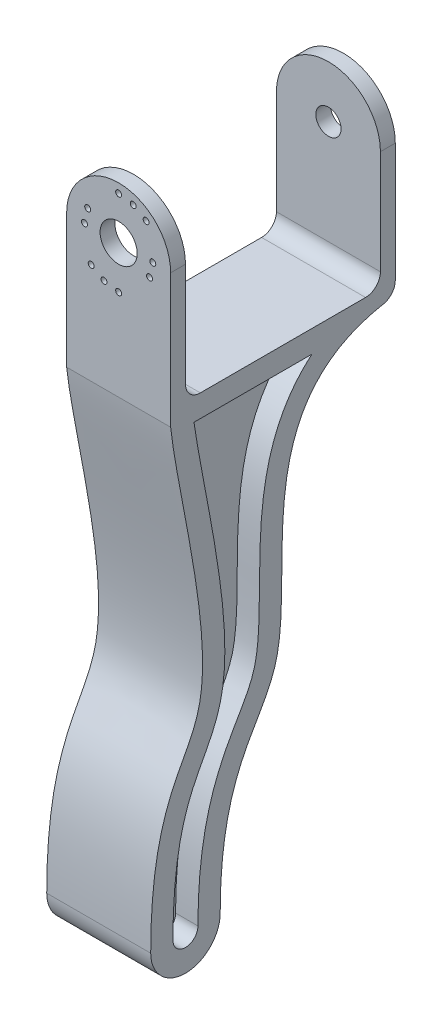
from build123d import *

# Parameters (mm, degrees)
SKETCH1_W           = 17.78
SKETCH1_H           = 33.3375
BOSS_EXTRUDE1_DEPTH = 2.54
SKETCH2_R           = 0.508
SKETCH2_R_2         = 3.175
BOSS_EXTRUDE2_DEPTH = 2.54
BOSS_EXTRUDE3_START = 2.54
SKETCH3_R           = 2.159
BOSS_EXTRUDE3_DEPTH = 2.54
BOSS_EXTRUDE5_DEPTH = 17.78
CUT_EXTRUDE2_DEPTH  = 3.81
CUT_EXTRUDE3_START  = -3.81
CUT_EXTRUDE3_DEPTH  = 3.81
FILLET1_START       = -19
FILLET1_DEPTH       = 20
FILLET1_START_2     = -17.78
FILLET1_2_DEPTH     = 17.78


with BuildPart() as part:
    # Sketch1 → Boss-Extrude1 (new body)
    with BuildSketch(Plane(origin=(0, 0, 0), x_dir=(1, 0, 0), z_dir=(0, 1, 0))):
        with Locations((-8.89, -16.66875)):
            Rectangle(SKETCH1_W, SKETCH1_H)
    extrude(amount=BOSS_EXTRUDE1_DEPTH)

    # Sketch2 → Boss-Extrude2 (add)
    with BuildSketch(Plane.XY.offset(33.3375)):
        with BuildLine():
            Line((-17.78, 0), (0, 0))
            Line((0, 0), (0, 22.86))
            ThreePointArc((0, 22.86), (-8.89, 31.75), (-17.78, 22.86))
            Line((-17.78, 22.86), (-17.78, 0))
        make_face()
        with Locations((-4.190027947, 28.448986398)):
            Circle(SKETCH2_R, mode=Mode.SUBTRACT)
        with Locations((-8.89, 15.5575)):
            Circle(SKETCH2_R, mode=Mode.SUBTRACT)
        with Locations((-13.589972053, 17.271013602)):
            Circle(SKETCH2_R, mode=Mode.SUBTRACT)
        with Locations((-14.732, 22.86)):
            Circle(SKETCH2_R, mode=Mode.SUBTRACT)
        with Locations((-11.391292974, 15.99923913)):
            Circle(SKETCH2_R, mode=Mode.SUBTRACT)
        with Locations((-14.179826087, 25.339254721)):
            Circle(SKETCH2_R, mode=Mode.SUBTRACT)
        with Locations((-8.89, 22.86)):
            Circle(SKETCH2_R_2, mode=Mode.SUBTRACT)
        with Locations((-3.600173913, 20.380745279)):
            Circle(SKETCH2_R, mode=Mode.SUBTRACT)
        with Locations((-3.048, 22.86)):
            Circle(SKETCH2_R, mode=Mode.SUBTRACT)
        with Locations((-8.89, 30.1625)):
            Circle(SKETCH2_R, mode=Mode.SUBTRACT)
        with Locations((-6.388707026, 29.72076087)):
            Circle(SKETCH2_R, mode=Mode.SUBTRACT)
    extrude(amount=BOSS_EXTRUDE2_DEPTH)

    # Sketch3 → Boss-Extrude3 (add)
    with BuildSketch(Plane(origin=(0, 0, 0), x_dir=(-1, 0, 0), z_dir=(0, 0, -1)).offset(BOSS_EXTRUDE3_START)):
        with BuildLine():
            Line((0, 22.86), (0, 0))
            Line((0, 0), (17.78, 0))
            Line((17.78, 0), (17.78, 22.86))
            ThreePointArc((17.78, 22.86), (8.89, 31.75), (0, 22.86))
        make_face()
        with Locations((8.89, 22.86)):
            Circle(SKETCH3_R, mode=Mode.SUBTRACT)
    extrude(amount=-BOSS_EXTRUDE3_DEPTH)

    # Sketch7 → Boss-Extrude5 (add)
    with BuildSketch(Plane.ZY.offset(17.78)):
        with BuildLine():
            Line((-0.264151635, 0), (35.8775, 0))
            add(Edge.make_bspline(
                [(35.8775, 0), (34.747575759, -10.483413435), (23.993931567, -49.656448715), (39.285331068, -53.149048012), (39.285331068, -76.2)],
                knots=[0, 0, 0, 0, 0.561590868, 1, 1, 1, 1], degree=3))
            ThreePointArc((39.285331068, -76.2), (33.341590809, -82.143740259), (27.39785055, -76.2))
            add(Edge.make_bspline(
                [(-0.264151635, 0), (22.699251274, -4.420985832), (9.107853477, -48.908327851), (27.39785055, -54.27437044), (27.39785055, -76.2)],
                knots=[0, 0, 0, 0, 0.58838778, 1, 1, 1, 1], degree=3))
        make_face()
    extrude(amount=-BOSS_EXTRUDE5_DEPTH)

    # Sketch8 → Cut-Extrude2 (cut)
    with BuildSketch(Plane.ZY.offset(17.78)):
        with BuildLine():
            Line((31.87998254, -1.27), (11.692102825, -1.27))
            add(Edge.make_bspline(
                [(11.692102825, -1.27), (12.329490215, -1.797961739), (12.933094236, -2.363198397), (13.787184198, -3.267673027), (14.063326101, -3.578603465), (14.598372835, -4.219482884), (14.857923986, -4.550402014), (16.097605696, -6.232124946), (16.914419625, -7.674525947), (17.924867424, -9.957247581), (18.226686047, -10.741395079), (18.75770144, -12.319459012), (18.988184221, -13.115418962), (19.592569091, -15.520520104), (19.879955273, -17.146774279), (20.299302948, -20.430025875), (20.430895911, -22.089601111), (20.599678207, -25.411936863), (20.636803846, -27.075451594), (20.67865973, -30.404089571), (20.682443911, -32.069259792), (20.720479253, -34.565408412), (20.738709961, -35.397182268), (20.801129707, -37.059441081), (20.845054145, -37.889939176), (20.982392235, -39.548478099), (21.074816708, -40.376568042), (21.286468297, -41.615077579), (21.36995575, -42.029357232), (21.572726897, -42.845983081), (21.691262012, -43.245940154), (22.363912109, -45.206759154), (23.165451305, -46.647067415), (24.407519941, -48.78815743), (24.827945274, -49.498734604), (25.64468202, -50.93163809), (26.041618909, -51.654615352), (27.165466006, -53.845963493), (27.8234689, -55.338028422), (28.933619451, -58.392484093), (29.388551341, -59.953923666), (30.126668316, -63.135476247), (30.410939534, -64.760898165), (30.838079835, -68.014087747), (30.982595978, -69.645919189), (31.167543607, -72.917475244), (31.20785055, -74.557209301), (31.20785055, -76.2)],
                knots=[0, 0, 0, 0, 0.03125, 0.03125, 0.046875, 0.046875, 0.0625, 0.0625, 0.125, 0.125, 0.15625, 0.15625, 0.1875, 0.1875, 0.25, 0.25, 0.3125, 0.3125, 0.375, 0.375, 0.4375, 0.4375, 0.46875, 0.46875, 0.5, 0.5, 0.53125, 0.53125, 0.546875, 0.546875, 0.5625, 0.5625, 0.625, 0.625, 0.65625, 0.65625, 0.6875, 0.6875, 0.75, 0.75, 0.8125, 0.8125, 0.875, 0.875, 0.9375, 0.9375, 1, 1, 1, 1], degree=3))
            ThreePointArc((31.20785055, -76.2), (33.341590809, -78.333740259), (35.475331068, -76.2))
            add(Edge.make_bspline(
                [(35.475331068, -76.2), (35.475331068, -74.59891608), (35.442328522, -73.001625639), (35.287530724, -69.817251041), (35.166036456, -68.230132286), (34.79753857, -65.070321456), (34.55101578, -63.497574112), (34.039906006, -61.154697774), (33.84568435, -60.376480634), (33.398546609, -58.826792987), (33.146503607, -58.05990662), (32.584304123, -56.555872408), (32.273225256, -55.817082229), (31.598571017, -54.362663568), (31.234783966, -53.64712848), (30.484711446, -52.225984708), (30.099036577, -51.51989769), (29.353314006, -50.097553632), (28.994109895, -49.38118555), (28.341640461, -47.923362101), (28.048377395, -47.181905876), (27.546707249, -45.666708842), (27.338073983, -44.893054089), (27.09111876, -43.70746341), (27.01970601, -43.307296259), (26.897279987, -42.509162839), (26.845976833, -42.1100683), (26.716854196, -40.912715076), (26.663581813, -40.114387456), (26.574836598, -37.719205009), (26.609016601, -36.12215458), (26.785471939, -32.927750164), (26.929107807, -31.328947255), (27.463994787, -26.542252957), (27.955318949, -23.373254872), (29.041327858, -17.052236889), (29.640872623, -13.901015305), (30.531911147, -9.172823068), (30.827709929, -7.596559566), (31.390084509, -4.439232344), (31.659048397, -2.858560896), (31.87998254, -1.27)],
                knots=[0, 0, 0, 0, 0.0625, 0.0625, 0.125, 0.125, 0.1875, 0.1875, 0.21875, 0.21875, 0.25, 0.25, 0.28125, 0.28125, 0.3125, 0.3125, 0.34375, 0.34375, 0.375, 0.375, 0.40625, 0.40625, 0.4375, 0.4375, 0.453125, 0.453125, 0.46875, 0.46875, 0.5, 0.5, 0.5625, 0.5625, 0.625, 0.625, 0.75, 0.75, 0.875, 0.875, 0.9375, 0.9375, 1, 1, 1, 1], degree=3))
        make_face()
    extrude(amount=-CUT_EXTRUDE2_DEPTH, mode=Mode.SUBTRACT)

    # Sketch9 → Cut-Extrude3 (cut)
    with BuildSketch(Plane(origin=(0, 0, 0), x_dir=(0, 0, -1), z_dir=(1, 0, 0)).offset(CUT_EXTRUDE3_START)):
        with BuildLine():
            Line((-11.692102825, -1.27), (-31.87998254, -1.27))
            add(Edge.make_bspline(
                [(-31.87998254, -1.27), (-31.657274592, -2.871314909), (-31.385801547, -4.464709015), (-30.818371841, -7.647520411), (-30.519962643, -9.236539341), (-29.621517161, -14.003073455), (-29.017536871, -17.179948025), (-28.199208606, -21.959495394), (-27.940716, -23.554997883), (-27.470213202, -26.753552893), (-27.257969555, -28.356567493), (-26.905486134, -31.574292118), (-26.764970951, -33.188911509), (-26.600139399, -36.413329948), (-26.5742329, -38.025249954), (-26.68367025, -40.442370979), (-26.74525272, -41.247949508), (-26.938608863, -42.85874733), (-27.071936421, -43.667615889), (-27.427560468, -45.240494251), (-27.649330164, -46.008954577), (-28.17466612, -47.512420124), (-28.47843167, -48.247343835), (-29.480288911, -50.415075343), (-30.271932345, -51.809620123), (-31.381249819, -53.933399988), (-31.737281071, -54.64791605), (-32.39111668, -56.091599244), (-32.689563076, -56.821075957), (-33.494491888, -59.033751249), (-33.911327537, -60.540990207), (-34.568189194, -63.60288278), (-34.809697436, -65.157138907), (-35.081291118, -67.512837521), (-35.156433699, -68.301724496), (-35.28037816, -69.878565078), (-35.329299977, -70.667595867), (-35.443105132, -73.036230119), (-35.475331068, -74.617361294), (-35.475331068, -76.2)],
                knots=[0, 0, 0, 0, 0.0625, 0.0625, 0.125, 0.125, 0.25, 0.25, 0.3125, 0.3125, 0.375, 0.375, 0.4375, 0.4375, 0.5, 0.5, 0.53125, 0.53125, 0.5625, 0.5625, 0.59375, 0.59375, 0.625, 0.625, 0.6875, 0.6875, 0.71875, 0.71875, 0.75, 0.75, 0.8125, 0.8125, 0.875, 0.875, 0.90625, 0.90625, 0.9375, 0.9375, 1, 1, 1, 1], degree=3))
            ThreePointArc((-35.475331068, -76.2), (-33.341590809, -78.333740259), (-31.20785055, -76.2))
            add(Edge.make_bspline(
                [(-31.20785055, -76.2), (-31.20785055, -74.567868048), (-31.16803655, -72.940517258), (-30.986335459, -69.698073378), (-30.844546912, -68.082968453), (-30.427543331, -64.868781453), (-30.152347923, -63.26969702), (-29.42575358, -60.09268799), (-28.970111579, -58.507772228), (-27.864424367, -55.43683222), (-27.211188917, -53.94504957), (-26.100218097, -51.764433844), (-25.708582932, -51.04683605), (-24.900055321, -49.622631633), (-24.482893419, -48.916109599), (-23.246407855, -46.790049869), (-22.442616166, -45.363829892), (-21.754958623, -43.444430809), (-21.632865788, -43.053898787), (-21.42199591, -42.258479656), (-21.333822228, -41.853332571), (-21.183157231, -41.031972401), (-21.120331601, -40.614830886), (-21.014003569, -39.781944527), (-20.970300665, -39.365128906), (-20.859397069, -38.113886662), (-20.812029535, -37.278679299), (-20.744530591, -35.60719241), (-20.724703124, -34.770900921), (-20.68353212, -32.261305616), (-20.679823958, -30.587307578), (-20.619946936, -25.567232626), (-20.520174116, -22.225109346), (-20.001894527, -18.086578744), (-19.878339369, -17.260814066), (-19.581501223, -15.614136338), (-19.407691345, -14.791082652), (-18.797878992, -12.346234841), (-18.277408614, -10.760308547), (-17.267840939, -8.469751296), (-16.893065224, -7.720996496), (-16.05510709, -6.257608567), (-15.597612775, -5.553662739), (-14.117437586, -3.546243805), (-12.982722301, -2.339047983), (-11.692102825, -1.27)],
                knots=[0, 0, 0, 0, 0.0625, 0.0625, 0.125, 0.125, 0.1875, 0.1875, 0.25, 0.25, 0.3125, 0.3125, 0.34375, 0.34375, 0.375, 0.375, 0.4375, 0.4375, 0.453125, 0.453125, 0.46875, 0.46875, 0.484375, 0.484375, 0.5, 0.5, 0.53125, 0.53125, 0.5625, 0.5625, 0.625, 0.625, 0.75, 0.75, 0.78125, 0.78125, 0.8125, 0.8125, 0.875, 0.875, 0.90625, 0.90625, 0.9375, 0.9375, 1, 1, 1, 1], degree=3))
        make_face()
    extrude(amount=CUT_EXTRUDE3_DEPTH, mode=Mode.SUBTRACT)

    # Fillet1: read off the stored shape, not the designer's step
    # Fillet1 outline → Fillet1 (cut)
    with BuildSketch(Plane.YZ.offset(FILLET1_START)):
        with BuildLine():
            Line((0, -2.54), (2.526227209, -2.54))
            ThreePointArc((2.526227209, -2.54), (0.826130911, -1.887133428), (0, -0.264151635))
            Line((0, -0.264151635), (0, -2.54))
        make_face()
    extrude(amount=FILLET1_DEPTH, mode=Mode.SUBTRACT)

    # Fillet1 2 outline → Fillet1 2 (add)
    with BuildSketch(Plane.YZ.offset(FILLET1_START_2)):
        with BuildLine():
            Line((2.54, 33.3375), (2.54, 30.7975))
            ThreePointArc((2.54, 30.7975), (3.283948776, 32.593551224), (5.08, 33.3375))
            Line((5.08, 33.3375), (2.54, 33.3375))
        make_face()
        with BuildLine():
            ThreePointArc((5.08, 0), (3.283948776, 0.743948776), (2.54, 2.54))
            Line((2.54, 2.54), (2.54, 0))
            Line((2.54, 0), (5.08, 0))
        make_face()
    extrude(amount=FILLET1_2_DEPTH)


solid = part.part
